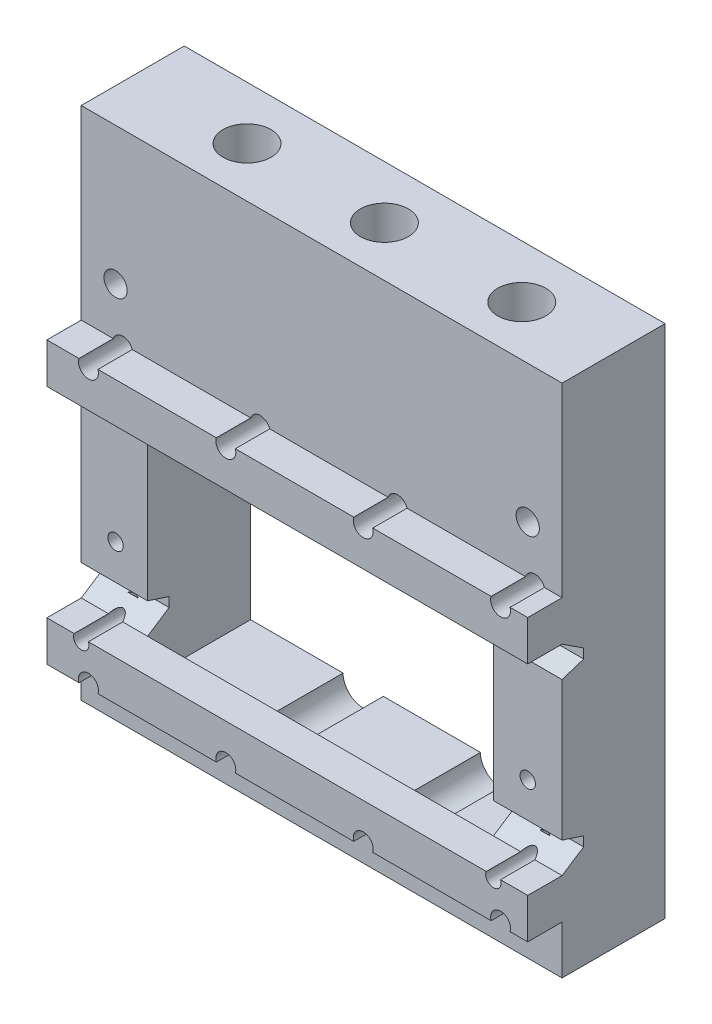
from build123d import *

# Parameters (mm, degrees)
SKETCH1_W            = 140
SKETCH1_H            = 150
SKETCH1_W_2          = 100.689655172
SKETCH1_H_2          = 60
BOSS_EXTRUDE1_DEPTH  = 30
CUT_EXTRUDE1_DEPTH   = 300
SKETCH11_W           = 140
SKETCH11_H           = 11.715455608
BOSS_EXTRUDE2_DEPTH  = 10
SKETCH3_R            = 3
CUT_EXTRUDE2_DEPTH   = 100
SKETCH4_R            = 7
CUT_EXTRUDE3_DEPTH   = 70
LPATTERN1_COUNT      = 3
LPATTERN1_PITCH      = 40
SKETCH5_R            = 2.238650571
CUT_EXTRUDE4_DEPTH   = 100
SKETCH6_R            = 4.368973
CUT_EXTRUDE5_DEPTH   = 25
LPATTERN2_COUNT      = 2
LPATTERN2_PITCH      = 20
LPATTERN2_COUNT_DIR2 = 2
LPATTERN2_PITCH_DIR2 = 120
SKETCH7_R            = 2.900161541
CUT_EXTRUDE6_DEPTH   = 40
SKETCH8_R            = 5.870976625
CUT_EXTRUDE7_DEPTH   = 25
LPATTERN3_COUNT      = 4
LPATTERN3_PITCH      = 40
LPATTERN3_COUNT_DIR2 = 2
LPATTERN3_PITCH_DIR2 = 80
SKETCH9_R            = 3.381759822
CUT_EXTRUDE8_DEPTH   = 100
CUT_EXTRUDE9_START   = -10
SKETCH10_R           = 6.982534733
CUT_EXTRUDE9_DEPTH   = 20
LPATTERN4_COUNT      = 2
LPATTERN4_PITCH      = 120


with BuildPart() as part:
    # Sketch1 → Boss-Extrude1 (new body)
    with BuildSketch(Plane.XY):
        with Locations((6.896551724, 31.293103448)):
            Rectangle(SKETCH1_W, SKETCH1_H)
        with Locations((6.551724138, 1.293103448)):
            Rectangle(SKETCH1_W_2, SKETCH1_H_2, mode=Mode.SUBTRACT)
    extrude(amount=BOSS_EXTRUDE1_DEPTH)

    # Sketch2 → Cut-Extrude1 (cut)
    with BuildSketch(Plane.ZY.offset(63.103448276)):
        Polygon((30, 40.467146905), (23.720048633, 36.378281812), (23.720048633, 33.58866414), (30, 31.544440585), align=None)
    cut_extrude1 = extrude(amount=-CUT_EXTRUDE1_DEPTH, mode=Mode.SUBTRACT)

    # Sketch11 → Boss-Extrude2 (add)
    with BuildSketch(Plane.XY.offset(30)):
        with Locations((6.896551724, 46.324874709)):
            Rectangle(SKETCH11_W, SKETCH11_H)
    boss_extrude2 = extrude(amount=BOSS_EXTRUDE2_DEPTH)

    # Mirror1: Cut-Extrude1, Boss-Extrude2 across plane
    add(cut_extrude1.mirror(Plane(origin=(0, 11.293103448, 0), x_dir=(0, 0, 1), z_dir=(0, -1, 0))), mode=Mode.SUBTRACT)
    add(boss_extrude2.mirror(Plane(origin=(0, 11.293103448, 0), x_dir=(0, 0, 1), z_dir=(0, -1, 0))))

    # Sketch3 → Cut-Extrude2 (cut)
    with BuildSketch(Plane(origin=(0, 106.293103448, 0), x_dir=(1, 0, 0), z_dir=(0, 1, 0))):
        with Locations((-29.404551137, -15.436210525)):
            Circle(SKETCH3_R)
    cut_extrude2 = extrude(amount=-CUT_EXTRUDE2_DEPTH, mode=Mode.SUBTRACT)

    # Sketch4 → Cut-Extrude3 (cut)
    with BuildSketch(Plane(origin=(0, 106.293103448, 0), x_dir=(1, 0, 0), z_dir=(0, 1, 0))):
        with Locations((-29.404551137, -15.436210525)):
            Circle(SKETCH4_R)
    cut_extrude3 = extrude(amount=-CUT_EXTRUDE3_DEPTH, mode=Mode.SUBTRACT)

    # LPattern1: Cut-Extrude2, Cut-Extrude3 ×3
    with Locations(*[(i * LPATTERN1_PITCH, 0, 0) for i in range(1, LPATTERN1_COUNT)]):
        add(cut_extrude2, mode=Mode.SUBTRACT)
        add(cut_extrude3, mode=Mode.SUBTRACT)

    # Sketch5 → Cut-Extrude4 (cut)
    with BuildSketch(Plane(origin=(0, 0, 0), x_dir=(-1, 0, 0), z_dir=(0, 0, -1))):
        with Locations((53.103448276, -18.706896552)):
            Circle(SKETCH5_R)
    cut_extrude4 = extrude(amount=-CUT_EXTRUDE4_DEPTH, mode=Mode.SUBTRACT)

    # Sketch6 → Cut-Extrude5 (cut)
    with BuildSketch(Plane(origin=(0, 0, 0), x_dir=(-1, 0, 0), z_dir=(0, 0, -1))):
        with Locations((53.103448276, -18.706896552)):
            Circle(SKETCH6_R)
    cut_extrude5 = extrude(amount=-CUT_EXTRUDE5_DEPTH, mode=Mode.SUBTRACT)

    # LPattern2: Cut-Extrude4, Cut-Extrude5 2 × 2
    with Locations(*[(j * LPATTERN2_PITCH_DIR2, i * LPATTERN2_PITCH, 0) for i in range(LPATTERN2_COUNT) for j in range(LPATTERN2_COUNT_DIR2) if (i, j) != (0, 0)]):
        add(cut_extrude4, mode=Mode.SUBTRACT)
        add(cut_extrude5, mode=Mode.SUBTRACT)

    # Sketch7 → Cut-Extrude6 (cut)
    with BuildSketch(Plane(origin=(0, 0, 0), x_dir=(-1, 0, 0), z_dir=(0, 0, -1))):
        with Locations((51.00310189, 51.293103448)):
            Circle(SKETCH7_R)
    cut_extrude6 = extrude(amount=-CUT_EXTRUDE6_DEPTH, mode=Mode.SUBTRACT)

    # Sketch8 → Cut-Extrude7 (cut)
    with BuildSketch(Plane(origin=(0, 0, 0), x_dir=(-1, 0, 0), z_dir=(0, 0, -1))):
        with Locations((51.00310189, 51.293103448)):
            Circle(SKETCH8_R)
    cut_extrude7 = extrude(amount=-CUT_EXTRUDE7_DEPTH, mode=Mode.SUBTRACT)

    # LPattern3: Cut-Extrude6, Cut-Extrude7 4 × 2
    with Locations(*[(i * LPATTERN3_PITCH, -j * LPATTERN3_PITCH_DIR2, 0) for i in range(LPATTERN3_COUNT) for j in range(LPATTERN3_COUNT_DIR2) if (i, j) != (0, 0)]):
        add(cut_extrude6, mode=Mode.SUBTRACT)
        add(cut_extrude7, mode=Mode.SUBTRACT)

    # Sketch9 → Cut-Extrude8 (cut)
    with BuildSketch(Plane(origin=(0, 0, 0), x_dir=(-1, 0, 0), z_dir=(0, 0, -1))):
        with Locations((-66.896551724, 66.293103448)):
            Circle(SKETCH9_R)
    cut_extrude8 = extrude(amount=-CUT_EXTRUDE8_DEPTH, mode=Mode.SUBTRACT)

    # Sketch10 → Cut-Extrude9 (cut)
    with BuildSketch(Plane.XY.offset(30).offset(CUT_EXTRUDE9_START)):
        with Locations((66.896551724, 66.293103448)):
            Circle(SKETCH10_R)
    cut_extrude9 = extrude(amount=-CUT_EXTRUDE9_DEPTH, mode=Mode.SUBTRACT)

    # LPattern4: Cut-Extrude8, Cut-Extrude9 ×2
    with Locations(*[(-i * LPATTERN4_PITCH, 0, 0) for i in range(1, LPATTERN4_COUNT)]):
        add(cut_extrude8, mode=Mode.SUBTRACT)
        add(cut_extrude9, mode=Mode.SUBTRACT)


solid = part.part
